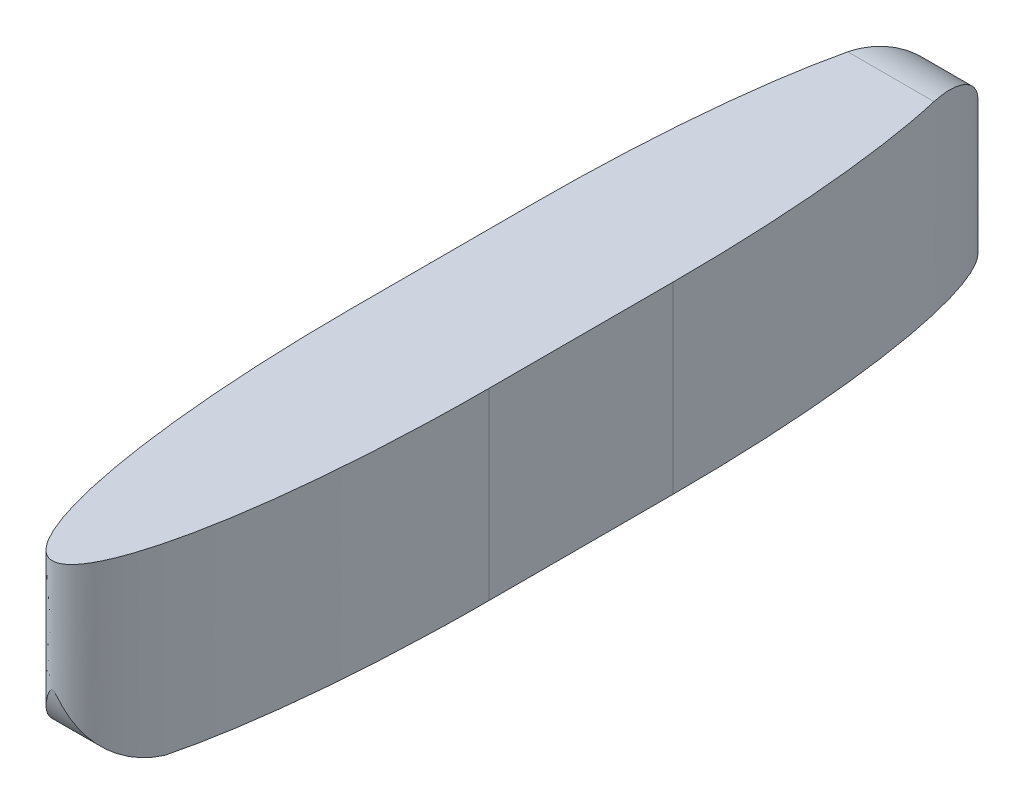
from build123d import *

# Parameters (mm, degrees)
SKETCH5_W           = 300
SKETCH5_H           = 400
BOSS_EXTRUDE1_DEPTH = 400
BOSS_EXTRUDE3_DEPTH = 400
CUT_EXTRUDE1_DEPTH  = 400
CUT_EXTRUDE2_DEPTH  = 400


with BuildPart() as part:
    # Sketch5 → Boss-Extrude1 (new body)
    with BuildSketch(Plane(origin=(0, 0, 0), x_dir=(1, 0, 0), z_dir=(0, 1, 0))):
        with Locations((150, 200)):
            Rectangle(SKETCH5_W, SKETCH5_H)
    extrude(amount=BOSS_EXTRUDE1_DEPTH)

    # Sketch11 → Boss-Extrude3 (add)
    with BuildSketch(Plane(origin=(0, 400, 0), x_dir=(1, 0, 0), z_dir=(0, 1, 0))):
        with BuildLine():
            add(Edge.make_bspline(
                [(300, 400), (300, 1200), (150, 1200), (0, 1200), (0, 400)],
                knots=[1.570796327, 1.570796327, 1.570796327, 3.141592654, 3.141592654, 4.71238898, 4.71238898, 4.71238898], degree=2, weights=[1, 0.707106781, 1, 0.707106781, 1]))
            Line((0, 400), (300, 400))
        make_face()
        with BuildLine():
            add(Edge.make_bspline(
                [(0, 0), (0, -800), (150, -800), (300, -800), (300, 0)],
                knots=[4.71238898, 4.71238898, 4.71238898, 6.283185307, 6.283185307, 7.853981634, 7.853981634, 7.853981634], degree=2, weights=[1, 0.707106781, 1, 0.707106781, 1]))
            Line((300, 0), (0, 0))
        make_face()
    extrude(amount=-BOSS_EXTRUDE3_DEPTH)

    # Sketch13 → Cut-Extrude1 (cut)
    with BuildSketch(Plane(origin=(0, 0, 0), x_dir=(0, 0, -1), z_dir=(1, 0, 0))):
        with BuildLine():
            ThreePointArc((-643.353757446, 0), (-748.698575006, 51.301424994), (-800, 156.646242554))
            Line((-800, 156.646242554), (-800, 0))
            Line((-800, 0), (-643.353757446, 0))
        make_face()
    extrude(amount=CUT_EXTRUDE1_DEPTH, mode=Mode.SUBTRACT)

    # Sketch18 → Cut-Extrude2 (cut)
    with BuildSketch(Plane(origin=(0, 0, 0), x_dir=(0, 0, -1), z_dir=(1, 0, 0))):
        with BuildLine():
            ThreePointArc((1024.410583578, 400), (1147.692827202, 347.692827202), (1200, 224.410583578))
            Line((1200, 224.410583578), (1200, 400))
            Line((1200, 400), (1024.410583578, 400))
        make_face()
    extrude(amount=CUT_EXTRUDE2_DEPTH, mode=Mode.SUBTRACT)


solid = part.part
